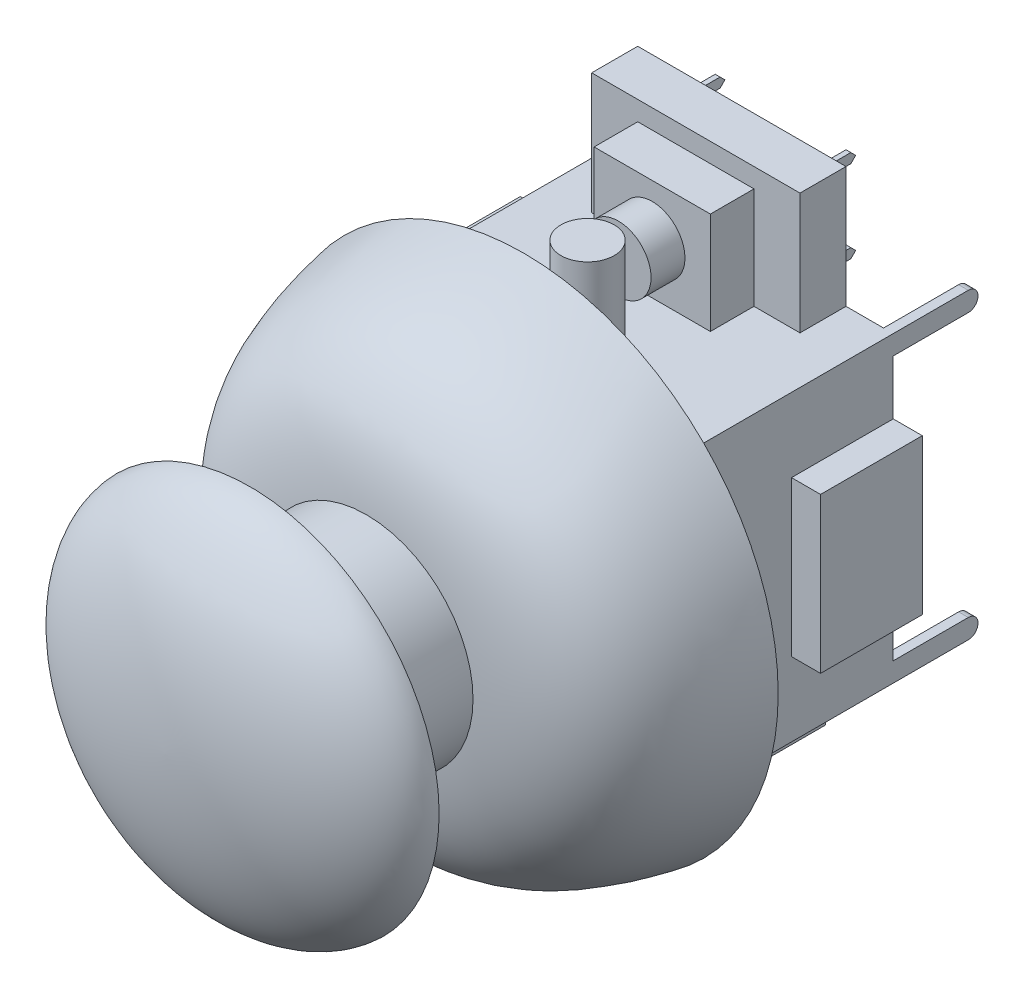
from build123d import *

# Parameters (mm, degrees)
SKETCH1_W            = 15.875
SKETCH1_H            = 15.875
BOSS_EXTRUDE1_DEPTH  = 11.938
SKETCH2_W            = 10.922
SKETCH2_H            = 6.35
BOSS_EXTRUDE2_DEPTH  = 2.413
SKETCH3_W            = 5.334
SKETCH3_H            = 8.128
BOSS_EXTRUDE3_DEPTH  = 1.524
SKETCH4_W            = 6.096
SKETCH4_H            = 5.334
BOSS_EXTRUDE4_DEPTH  = 2.286
SKETCH5_R            = 1.7145
BOSS_EXTRUDE5_DEPTH  = 1.778
SKETCH6_R            = 1.397
BOSS_EXTRUDE6_DEPTH  = 4.318
SKETCH7_W            = 9.779
SKETCH7_H            = 11.43
BOSS_EXTRUDE7_DEPTH  = 3.175
SKETCH8_W            = 11.43
SKETCH8_H            = 9.779
BOSS_EXTRUDE8_DEPTH  = 3.175
SKETCH9_R            = 2.413
SKETCH9_R_2          = 1.8415
CUT_EXTRUDE1_DEPTH   = 0.508
SKETCH10_R           = 2.413
SKETCH10_R_2         = 1.8415
CUT_EXTRUDE2_DEPTH   = 0.508
SKETCH12_W           = 0.508
SKETCH12_H           = 4.445
EXTRUDE_THIN1_DEPTH  = 1.016
SKETCH13_W           = 0.508
SKETCH13_H           = 4.445
EXTRUDE_THIN2_DEPTH  = 1.016
FILLET1_R            = 0.508
BOSS_EXTRUDE9_DEPTH  = 0.254
BOSS_EXTRUDE10_DEPTH = 0.254
SKETCH16_W           = 0.254
SKETCH16_H           = 0.508
BOSS_EXTRUDE11_DEPTH = 2.54
CHAMFER1_SIZE        = 0.254


with BuildPart() as part:
    # Sketch1 → Boss-Extrude1 (new body)
    with BuildSketch(Plane.XY):
        with Locations((7.9375, 7.9375)):
            Rectangle(SKETCH1_W, SKETCH1_H)
    extrude(amount=BOSS_EXTRUDE1_DEPTH)

    # Sketch2 → Boss-Extrude2 (add)
    with BuildSketch(Plane(origin=(0, 0, 0), x_dir=(-1, 0, 0), z_dir=(0, 0, -1))):
        with Locations((-7.9375, 19.05)):
            Rectangle(SKETCH2_W, SKETCH2_H)
    extrude(amount=-BOSS_EXTRUDE2_DEPTH)

    # Sketch3 → Boss-Extrude3 (add)
    with BuildSketch(Plane(origin=(15.875, 0, 0), x_dir=(0, 0, -1), z_dir=(1, 0, 0))):
        with Locations((-2.667, 7.9375)):
            Rectangle(SKETCH3_W, SKETCH3_H)
    extrude(amount=BOSS_EXTRUDE3_DEPTH)

    # Sketch4 → Boss-Extrude4 (add)
    with BuildSketch(Plane.XY.offset(2.413)):
        with Locations((7.9375, 18.542)):
            Rectangle(SKETCH4_W, SKETCH4_H)
    extrude(amount=BOSS_EXTRUDE4_DEPTH)

    # Sketch5 → Boss-Extrude5 (add)
    with BuildSketch(Plane.XY.offset(4.699)):
        with Locations(Location((7.9375, 18.542, 0), (0, 0, 180))):
            Circle(SKETCH5_R)
    extrude(amount=BOSS_EXTRUDE5_DEPTH)

    # Sketch6 → Boss-Extrude6 (add)
    with BuildSketch(Plane(origin=(0, 15.875, 0), x_dir=(1, 0, 0), z_dir=(0, 1, 0))):
        with Locations(Location((7.9375, -8.090189982, 0), (0, 0, 90))):
            Circle(SKETCH6_R)
    extrude(amount=BOSS_EXTRUDE6_DEPTH)



with BuildPart() as body_2:
    # Sketch7 → Boss-Extrude7 (new body)
    with BuildSketch(Plane.XZ):
        with Locations((7.9375, 6.223)):
            Rectangle(SKETCH7_W, SKETCH7_H)
    extrude(amount=BOSS_EXTRUDE7_DEPTH)

    # Sketch10 → Cut-Extrude2 (cut)
    # profile 1 of 5: a face of its own
    with BuildSketch(Plane.XZ.offset(3.175)):
        with Locations(Location((7.9375, 6.858, 0), (0, 0, 270))):
            Circle(SKETCH10_R)
        with Locations(Location((7.9375, 6.858, 0), (0, 0, 270))):
            Circle(SKETCH10_R_2, mode=Mode.SUBTRACT)
    # profile 2 of 5: a face of its own
    with BuildSketch(Plane.XZ.offset(3.175)):
        with BuildLine():
            Line((3.429447205, 7.62), (4.98628669, 7.62))
            ThreePointArc((4.98628669, 7.62), (5.782238531, 9.013261469), (7.1755, 9.80921331))
            Line((7.1755, 9.80921331), (7.1755, 11.366052795))
            ThreePointArc((7.1755, 11.366052795), (4.704607796, 10.090892204), (3.429447205, 7.62))
        make_face()
    # profile 3 of 5: a face of its own
    with BuildSketch(Plane.XZ.offset(3.175)):
        with BuildLine():
            Line((3.429447205, 6.096), (4.98628669, 6.096))
            ThreePointArc((4.98628669, 6.096), (5.782238531, 4.702738531), (7.1755, 3.90678669))
            Line((7.1755, 3.90678669), (7.1755, 2.349947205))
            ThreePointArc((7.1755, 2.349947205), (4.704607796, 3.625107796), (3.429447205, 6.096))
        make_face()
    # profile 4 of 5: a face of its own
    with BuildSketch(Plane.XZ.offset(3.175)):
        with BuildLine():
            Line((8.6995, 11.366052795), (8.6995, 9.80921331))
            ThreePointArc((8.6995, 9.80921331), (10.092761469, 9.013261469), (10.88871331, 7.62))
            Line((10.88871331, 7.62), (12.445552795, 7.62))
            ThreePointArc((12.445552795, 7.62), (11.170392204, 10.090892204), (8.6995, 11.366052795))
        make_face()
    # profile 5 of 5: a face of its own
    with BuildSketch(Plane.XZ.offset(3.175)):
        with BuildLine():
            Line((12.445552795, 6.096), (10.88871331, 6.096))
            ThreePointArc((10.88871331, 6.096), (10.092761469, 4.702738531), (8.6995, 3.90678669))
            Line((8.6995, 3.90678669), (8.6995, 2.349947205))
            ThreePointArc((8.6995, 2.349947205), (11.170392204, 3.625107796), (12.445552795, 6.096))
        make_face()
    extrude(amount=-CUT_EXTRUDE2_DEPTH, mode=Mode.SUBTRACT)


with BuildPart() as body_3:
    # Sketch8 → Boss-Extrude8 (new body)
    with BuildSketch(Plane.ZY):
        with Locations((6.223, 7.9375)):
            Rectangle(SKETCH8_W, SKETCH8_H)
    extrude(amount=BOSS_EXTRUDE8_DEPTH)

    # Sketch9 → Cut-Extrude1 (cut)
    # profile 1 of 5: a face of its own
    with BuildSketch(Plane.ZY.offset(3.175)):
        with Locations((6.858, 7.9375)):
            Circle(SKETCH9_R)
        with Locations((6.858, 7.9375)):
            Circle(SKETCH9_R_2, mode=Mode.SUBTRACT)
    # profile 2 of 5: a face of its own
    with BuildSketch(Plane.ZY.offset(3.175)):
        with BuildLine():
            Line((7.62, 12.445552795), (7.62, 10.88871331))
            ThreePointArc((7.62, 10.88871331), (9.013261469, 10.092761469), (9.80921331, 8.6995))
            Line((9.80921331, 8.6995), (11.366052795, 8.6995))
            ThreePointArc((11.366052795, 8.6995), (10.090892204, 11.170392204), (7.62, 12.445552795))
        make_face()
    # profile 3 of 5: a face of its own
    with BuildSketch(Plane.ZY.offset(3.175)):
        with BuildLine():
            Line((6.096, 12.445552795), (6.096, 10.88871331))
            ThreePointArc((6.096, 10.88871331), (4.702738531, 10.092761469), (3.90678669, 8.6995))
            Line((3.90678669, 8.6995), (2.349947205, 8.6995))
            ThreePointArc((2.349947205, 8.6995), (3.625107796, 11.170392204), (6.096, 12.445552795))
        make_face()
    # profile 4 of 5: a face of its own
    with BuildSketch(Plane.ZY.offset(3.175)):
        with BuildLine():
            Line((11.366052795, 7.1755), (9.80921331, 7.1755))
            ThreePointArc((9.80921331, 7.1755), (9.013261469, 5.782238531), (7.62, 4.98628669))
            Line((7.62, 4.98628669), (7.62, 3.429447205))
            ThreePointArc((7.62, 3.429447205), (10.090892204, 4.704607796), (11.366052795, 7.1755))
        make_face()
    # profile 5 of 5: a face of its own
    with BuildSketch(Plane.ZY.offset(3.175)):
        with BuildLine():
            Line((6.096, 3.429447205), (6.096, 4.98628669))
            ThreePointArc((6.096, 4.98628669), (4.702738531, 5.782238531), (3.90678669, 7.1755))
            Line((3.90678669, 7.1755), (2.349947205, 7.1755))
            ThreePointArc((2.349947205, 7.1755), (3.625107796, 4.704607796), (6.096, 3.429447205))
        make_face()
    extrude(amount=-CUT_EXTRUDE1_DEPTH, mode=Mode.SUBTRACT)


with BuildPart() as part_1:
    add(part.part)

    add(body_3.part)  # Revolve1 merges body 3

    add(body_2.part)  # Revolve1 merges body 2
    # Sketch11 → Revolve1 (revolve)
    with BuildSketch(Plane(origin=(7.9375, 7.9375, 0), x_dir=(-0.7071067811865475, 0.7071067811865477, 0), z_dir=(-0.7071067811865477, -0.7071067811865475, 0)), mode=Mode.PRIVATE) as revolve1_sk:
        with BuildLine():
            Line((0, -11.938), (0, -30.226))
            add(Edge.make_bspline(
                [(9.906, -25.781), (9.751729045, -27.856462125), (6.04050774, -30.161976774), (0, -30.226)],
                knots=[0, 0, 0, 0, 1, 1, 1, 1], degree=3))
            Line((9.906, -25.781), (5.588, -24.511))
            Line((5.588, -24.511), (5.588, -19.685))
            add(Edge.make_bspline(
                [(5.588, -19.685), (10.703599442, -19.17170065), (12.337124929, -16.678247384), (13.335, -11.43)],
                knots=[0, 0, 0, 0, 1, 1, 1, 1], degree=3))
            Line((13.335, -11.43), (12.81776957, -11.43))
            add(Edge.make_bspline(
                [(5.08, -19.225421832), (5.399913167, -19.193321739), (6.061720289, -19.129363969), (7.20278515, -18.93540179), (8.438114269, -18.57623304), (9.614134976, -17.958168192), (10.555522363, -17.145380616), (11.317238514, -16.106567706), (11.935580098, -14.811198195), (12.353250651, -13.497363461), (12.632984775, -12.344667479), (12.761465886, -11.721646833), (12.81776957, -11.43)],
                knots=[-0.02979657, -0.02979657, -0.02979657, -0.02979657, 0.034565716, 0.098928001, 0.227652573, 0.356377144, 0.485101715, 0.613826286, 0.742550858, 0.871275429, 0.935637714, 0.993693442, 0.993693442, 0.993693442, 0.993693442], degree=3))
            Line((5.08, -19.225421832), (3.1115, -15.178653632))
            Line((3.1115, -15.178653632), (3.1115, -11.938))
            Line((3.1115, -11.938), (0, -11.938))
        make_face()
    revolve(revolve1_sk.sketch.rotate(Axis((7.9375, 7.9375, -0.5969), (0, 0, 1)), 45), axis=Axis((7.9375, 7.9375, -0.5969), (0, 0, 1)))

    # Sketch12 → Extrude-Thin1 (add)
    with BuildSketch(Plane.XZ):
        with Locations((0.254, -2.2225)):
            Rectangle(SKETCH12_W, SKETCH12_H)
        with Locations((15.621, -2.2225)):
            Rectangle(SKETCH12_W, SKETCH12_H)
    extrude(amount=-EXTRUDE_THIN1_DEPTH)

    # Sketch13 → Extrude-Thin2 (add)
    with BuildSketch(Plane(origin=(0, 15.875, 0), x_dir=(1, 0, 0), z_dir=(0, 1, 0))):
        with Locations((0.254, 2.2225)):
            Rectangle(SKETCH13_W, SKETCH13_H)
        with Locations((15.621, 2.2225)):
            Rectangle(SKETCH13_W, SKETCH13_H)
    extrude(amount=-EXTRUDE_THIN2_DEPTH)

    # Fillet1
    fillet1_edges = [part_1.edges().sort_by_distance(p)[0] for p in [
        (0.254, 1.016, -4.445),
        (0.254, 15.875, -4.445),
        (0.254, 14.859, -4.445),
        (15.621, 15.875, -4.445),
        (15.621, 14.859, -4.445),
        (15.621, 1.016, -4.445),
        (15.621, 0, -4.445),
        (0.254, 0, -4.445),
    ]]
    fillet(fillet1_edges, radius=FILLET1_R - 0.0001)  # a hair under: the kernel refuses the full size

    # Sketch14 → Boss-Extrude9 (add, symmetric)
    with BuildSketch(Plane(origin=(0, -1.5875, 0), x_dir=(-1, 0, 0), z_dir=(0, -1, 0))):
        Polygon((-10.0965, -0.508), (-10.0965, 3.697342898), (-10.4775, 4.298407671), (-10.8585, 3.697342898), (-10.8585, -0.508), align=None)
        Polygon((-7.5565, -0.508), (-7.5565, 3.697342898), (-7.9375, 4.298407671), (-8.3185, 3.697342898), (-8.3185, -0.508), align=None)
        Polygon((-5.0165, -0.508), (-5.0165, 3.697342898), (-5.3975, 4.298407671), (-5.7785, 3.697342898), (-5.7785, -0.508), align=None)
    extrude(amount=BOSS_EXTRUDE9_DEPTH, both=True)

    # Sketch15 → Boss-Extrude10 (add, symmetric)
    with BuildSketch(Plane.ZY.offset(1.5875)):
        Polygon((0.508, 8.3185), (-3.697342898, 8.3185), (-4.298407671, 7.9375), (-3.697342898, 7.5565), (0.508, 7.5565), align=None)
        Polygon((0.508, 5.7785), (-3.697342898, 5.7785), (-4.298407671, 5.3975), (-3.697342898, 5.0165), (0.508, 5.0165), align=None)
        Polygon((0.508, 10.8585), (-3.697342898, 10.8585), (-4.298407671, 10.4775), (-3.697342898, 10.0965), (0.508, 10.0965), align=None)
    extrude(amount=BOSS_EXTRUDE10_DEPTH, both=True)

    # Sketch16 → Boss-Extrude11 (add)
    with BuildSketch(Plane(origin=(0, 0, 0), x_dir=(-1, 0, 0), z_dir=(0, 0, -1))):
        with Locations((-11.2395, 20.447)):
            Rectangle(SKETCH16_W, SKETCH16_H)
        with Locations((-4.3815, 20.447)):
            Rectangle(SKETCH16_W, SKETCH16_H)
        with Locations((-4.3815, 16.129)):
            Rectangle(SKETCH16_W, SKETCH16_H)
        with Locations((-11.2395, 16.129)):
            Rectangle(SKETCH16_W, SKETCH16_H)
    extrude(amount=BOSS_EXTRUDE11_DEPTH)

    # Chamfer1
    chamfer1_edges = [part_1.edges().sort_by_distance(p)[0] for p in [
        (11.2395, 15.875, -2.54),
        (11.2395, 16.383, -2.54),
        (4.3815, 15.875, -2.54),
        (4.3815, 16.383, -2.54),
        (4.3815, 20.193, -2.54),
        (4.3815, 20.701, -2.54),
        (11.2395, 20.193, -2.54),
        (11.2395, 20.701, -2.54),
    ]]
    chamfer(chamfer1_edges, length=CHAMFER1_SIZE - 0.0001)  # a hair under: the kernel refuses the full size


solid = part_1.part
